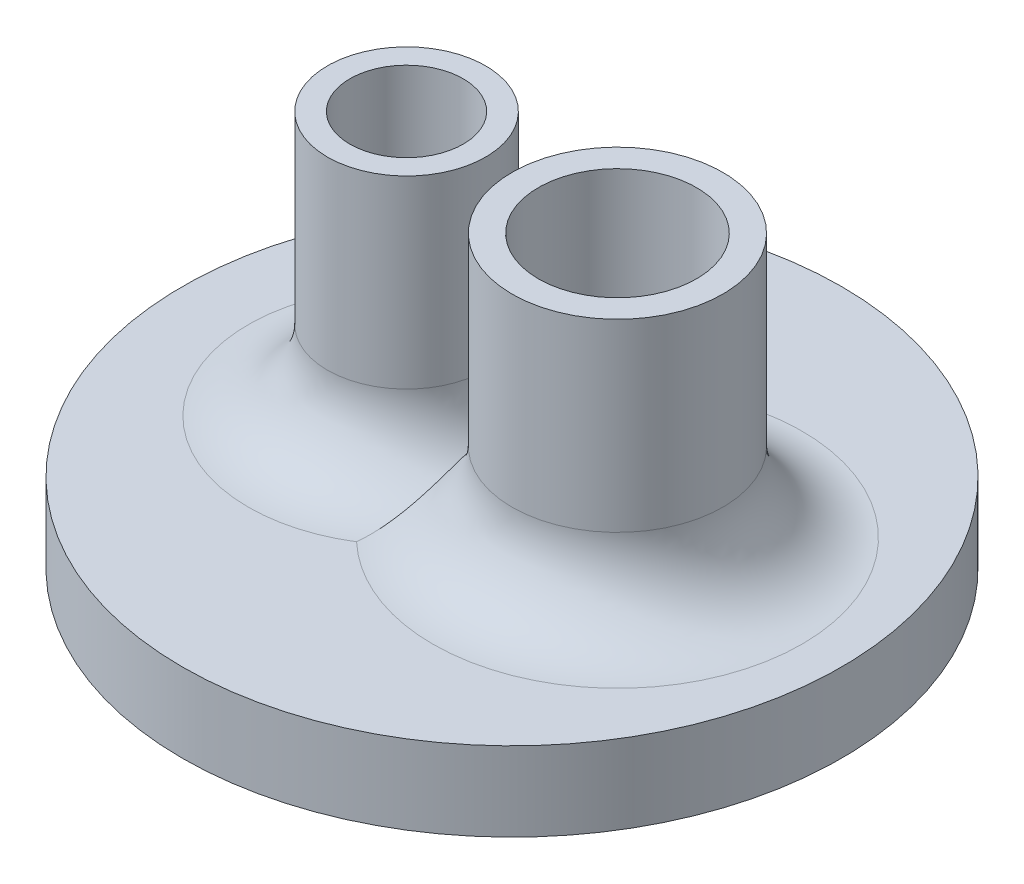
from build123d import *

# Parameters (mm, degrees)
SKETCH1_R           = 12.5
BOSS_EXTRUDE1_DEPTH = 3
SKETCH2_R           = 4
SKETCH2_R_2         = 3
BOSS_EXTRUDE2_DEPTH = 10
SKETCH3_R           = 2.15
SKETCH3_R_2         = 3
CUT_EXTRUDE1_DEPTH  = 22.943108257
FILLET1_R           = 3


with BuildPart() as part:
    # Sketch1 → Boss-Extrude1 (new body)
    with BuildSketch(Plane(origin=(0, 0, 0), x_dir=(1, 0, 0), z_dir=(0, 1, 0))):
        with Locations(Location((0, 0, 0), (0, 0, 270))):
            Circle(SKETCH1_R)
    extrude(amount=BOSS_EXTRUDE1_DEPTH)

    # Sketch2 → Boss-Extrude2 (add)
    with BuildSketch(Plane(origin=(0, 3, 0), x_dir=(1, 0, 0), z_dir=(0, 1, 0))):
        with Locations(Location((4, 0, 0), (0, 0, 270))):
            Circle(SKETCH2_R)
        with Locations(Location((-4, 0, 0), (0, 0, 270))):
            Circle(SKETCH2_R_2)
    extrude(amount=BOSS_EXTRUDE2_DEPTH)

    # Sketch3 → Cut-Extrude1 (cut, through all)
    with BuildSketch(Plane(origin=(0, 13, 0), x_dir=(1, 0, 0), z_dir=(0, 1, 0))):
        with Locations(Location((-4, 0, 0), (0, 0, 270))):
            Circle(SKETCH3_R)
        with Locations(Location((4, 0, 0), (0, 0, 270))):
            Circle(SKETCH3_R_2)
    extrude(amount=-CUT_EXTRUDE1_DEPTH, mode=Mode.SUBTRACT)

    # Fillet1
    # the kernel refuses this fillet: 3 mm, written as the material it adds along each edge
    with BuildSketch(Plane(origin=(4, 3, 0), x_dir=(0, 0, 1), z_dir=(-1, 0, 0))) as fillet1_piece_1_section:
        with BuildLine():
            CenterArc((4 + FILLET1_R, FILLET1_R), FILLET1_R, 180, 90)
            Line((4, FILLET1_R), (4, 0))
            Line((4, 0), (4 + FILLET1_R, 0))
        make_face()
    fillet1_piece_1 = revolve(axis=Axis((4, 3, 0), (0, 1, 0)), mode=Mode.PRIVATE)
    fillet1_piece_1 = fillet1_piece_1 - Plane(origin=(-4, 3.851709764, 0), x_dir=(0, 0, 1), z_dir=(0, -1, 0)) * Cylinder(3, 29, mode=Mode.PRIVATE)
    add(fillet1_piece_1)
    with BuildSketch(Plane(origin=(-4, 3, 0), x_dir=(0, 0, 1), z_dir=(-1, 0, 0))) as fillet1_piece_2_section:
        with BuildLine():
            CenterArc((3 + FILLET1_R, FILLET1_R), FILLET1_R, 180, 90)
            Line((3, FILLET1_R), (3, 0))
            Line((3, 0), (3 + FILLET1_R, 0))
        make_face()
    fillet1_piece_2 = revolve(axis=Axis((-4, 3, 0), (0, 1, 0)), mode=Mode.PRIVATE)
    fillet1_piece_2 = fillet1_piece_2 - Plane(origin=(4, 3.853854746, 0), x_dir=(0, 0, 1), z_dir=(0, -1, 0)) * Cylinder(4, 24, mode=Mode.PRIVATE)
    add(fillet1_piece_2)


solid = part.part
